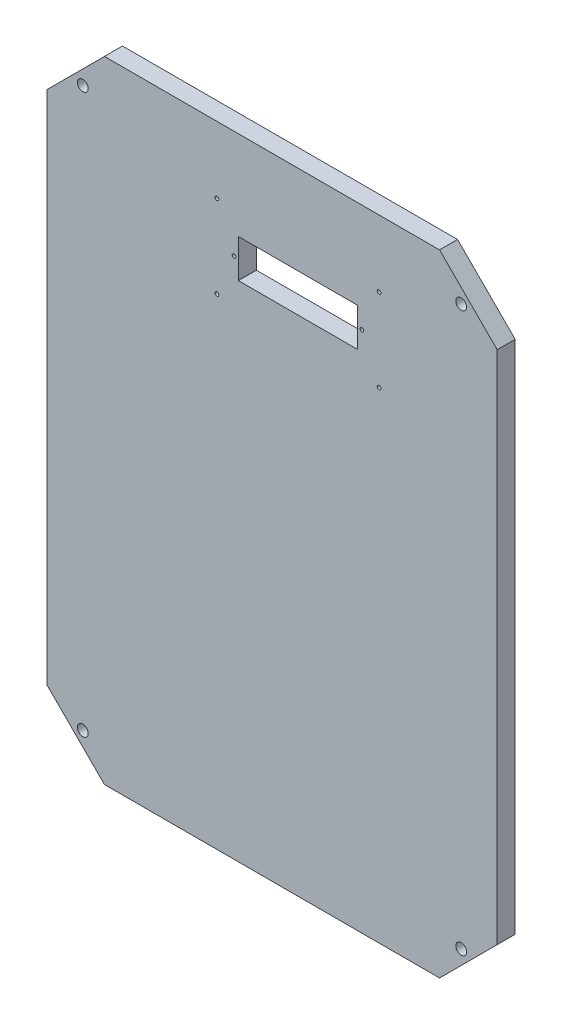
from build123d import *

# Parameters (mm, degrees)
ESQUISSE1_R        = 3
ESQUISSE1_R_2      = 1.05
ESQUISSE1_R_3      = 1
ESQUISSE1_W        = 66.2
ESQUISSE1_H        = 21.2
BOSS_EXTRU_1_DEPTH = 10


with BuildPart() as part:
    # Esquisse1 → Boss.-Extru.1 (new body)
    with BuildSketch(Plane.XY):
        Polygon((893.168811445, 495.110093658), (925.168811445, 527.110093658), (925.168811445, 813.110093658), (893.168811445, 845.110093658), (707.168811445, 845.110093658), (675.168811445, 813.110093658), (675.168811445, 527.110093658), (707.168811445, 495.110093658), align=None)
        with Locations((695.168811445, 515.110093658)):
            Circle(ESQUISSE1_R, mode=Mode.SUBTRACT)
        with Locations((695.168811445, 825.110093658)):
            Circle(ESQUISSE1_R, mode=Mode.SUBTRACT)
        with Locations((905.168811445, 825.110093658)):
            Circle(ESQUISSE1_R, mode=Mode.SUBTRACT)
        with Locations((905.168811445, 515.110093658)):
            Circle(ESQUISSE1_R, mode=Mode.SUBTRACT)
        with Locations((859.601426779, 808.110093658)):
            Circle(ESQUISSE1_R_2, mode=Mode.SUBTRACT)
        with Locations((769.601426779, 808.110093658)):
            Circle(ESQUISSE1_R_2, mode=Mode.SUBTRACT)
        with Locations((769.601426779, 762.110093658)):
            Circle(ESQUISSE1_R_2, mode=Mode.SUBTRACT)
        with Locations((859.601426779, 762.110093658)):
            Circle(ESQUISSE1_R_2, mode=Mode.SUBTRACT)
        with Locations((850.101426779, 785.110093658)):
            Circle(ESQUISSE1_R_3, mode=Mode.SUBTRACT)
        with Locations((779.101426779, 785.110093658)):
            Circle(ESQUISSE1_R_3, mode=Mode.SUBTRACT)
        with Locations((814.601426779, 785.110093658)):
            Rectangle(ESQUISSE1_W, ESQUISSE1_H, mode=Mode.SUBTRACT)
    extrude(amount=BOSS_EXTRU_1_DEPTH)


solid = part.part
